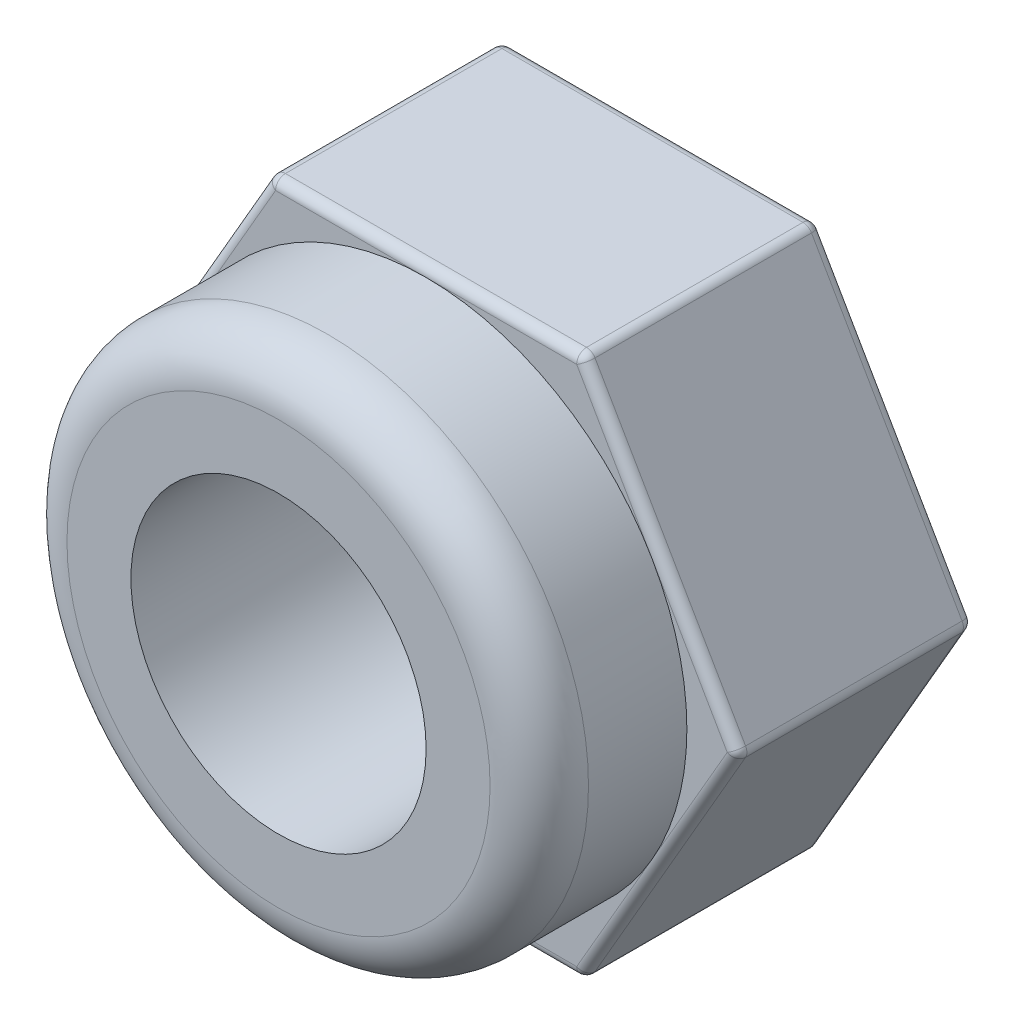
from build123d import *

# Parameters (mm, degrees)
EXTRUDE_1_DEPTH     = 2.4
EXTRUDE_START       = -2.4
SKETCH_2_R          = 2.65
EXTRUDE_2_DEPTH     = 3.9
FILLET_1_R          = 0.5
FILLET_2_R          = 0.1
SKETCH_3_R          = 1.5
CUT_EXTRUDE_1_DEPTH = 6.723453712


with BuildPart() as part:
    # 草图1 → 凸台-拉伸1 (new body)
    with BuildSketch(Plane.XY):
        Polygon((3.175426481, 0), (1.58771324, 2.75), (-1.58771324, 2.75), (-3.175426481, 0), (-1.58771324, -2.75), (1.58771324, -2.75), align=None)
    extrude(amount=EXTRUDE_1_DEPTH)

    # 草图2 → 凸台-拉伸2 (add)
    with BuildSketch(Plane.XY.offset(2.4).offset(EXTRUDE_START)):
        Circle(SKETCH_2_R)
    extrude(amount=EXTRUDE_2_DEPTH)

    # 圆角1
    fillet_1_edges = [part.edges().sort_by_distance(p)[0] for p in [
        (-2.65, 0, 3.9),
    ]]
    fillet(fillet_1_edges, radius=FILLET_1_R)

    # 圆角2
    fillet_2_edges = [part.edges().sort_by_distance(p)[0] for p in [
        (0, 2.75, 2.4),
        (1.58771324, -2.75, 1.2),
        (-1.58771324, -2.75, 1.2),
        (-3.175426481, 0, 1.2),
        (-1.58771324, 2.75, 1.2),
        (1.58771324, 2.75, 1.2),
        (3.175426481, 0, 1.2),
        (-2.38156986, 1.375, 2.4),
        (-2.38156986, -1.375, 2.4),
        (0, -2.75, 2.4),
        (2.38156986, -1.375, 2.4),
        (0, -2.75, 0),
        (-2.38156986, -1.375, 0),
        (-2.38156986, 1.375, 0),
        (2.38156986, 1.375, 2.4),
        (0, 2.75, 0),
        (2.38156986, 1.375, 0),
        (2.38156986, -1.375, 0),
    ]]
    fillet(fillet_2_edges, radius=FILLET_2_R - 0.0001)  # a hair under: the kernel refuses the full size

    # 草图3 → 切除-拉伸1 (cut, through all)
    with BuildSketch(Plane.XY.offset(3.9)):
        Circle(SKETCH_3_R)
    extrude(amount=-CUT_EXTRUDE_1_DEPTH, mode=Mode.SUBTRACT)


solid = part.part
